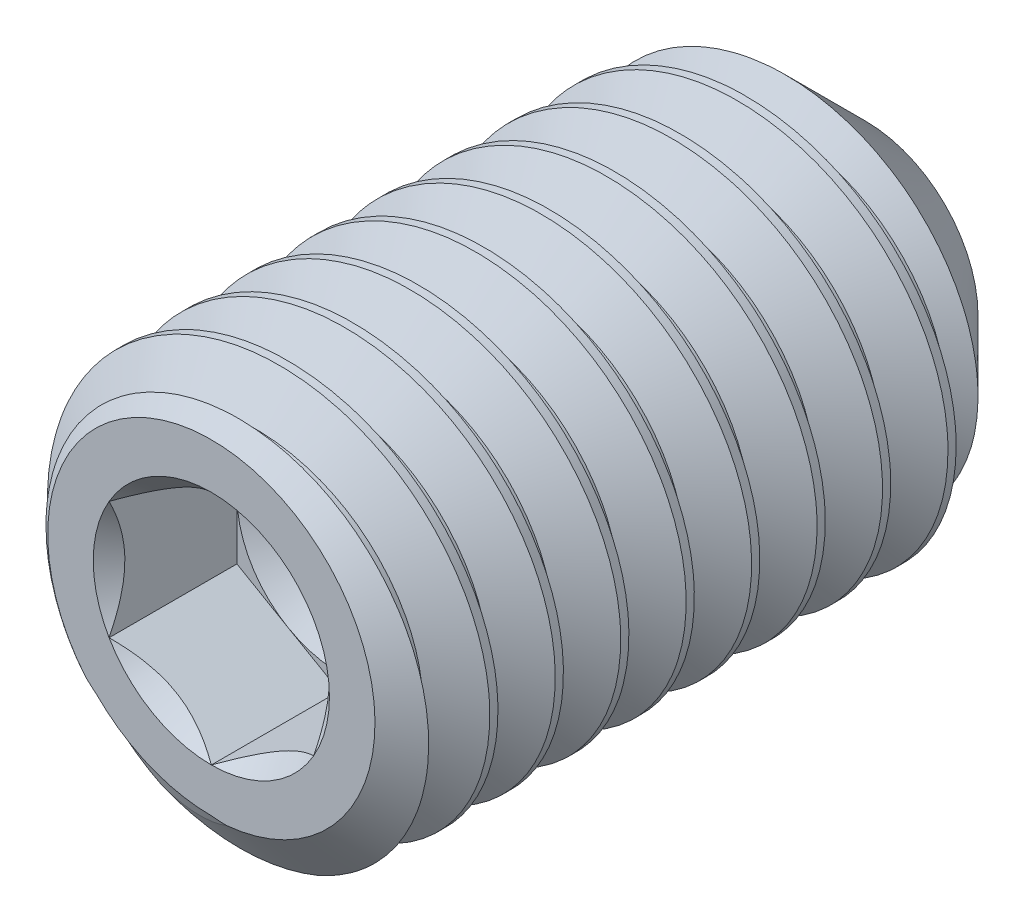
from build123d import *

# Parameters (mm, degrees)
CUT_SWEEP2_PITCH    = 0.8
CUT_EXTRUDE10_DEPTH = 1.5625


with BuildPart() as part:
    # Sketch22 → Revolve1 (revolve)
    with BuildSketch(Plane(origin=(0, 0, 0), x_dir=(0, 0, -1), z_dir=(1, 0, 0)), mode=Mode.PRIVATE) as revolve1_sk:
        Polygon((-3.588436834, 0), (-3.588436834, 2), (-3.238333065, 2.5), (3.281475432, 2.5), (4.411563166, 1.369912266), (3.588436834, 0), align=None)
    revolve(revolve1_sk.sketch.rotate(Axis((0, 0, -3.588436834), (0, 0, -1)), 180), axis=Axis((0, 0, -3.588436834), (0, 0, -1)))

    # Cut-Sweep2: the profile of Sketch28 profile screwed along a right-hand helix of 11 turns, 8 arcs to a turn; built about Z, then put on its axis
    cut_sweep2_z = Axis((0, 0, 0), (0, 0, 1))
    cut_sweep2_corners = [(2.5003, 0, 0.000173205), (2.5003, 0, -0.700173205), (1.980384758, 0, -0.4), (1.980384758, 0, -0.3)]
    with BuildLine(mode=Mode.PRIVATE) as cut_sweep2_profile:
        Line(cut_sweep2_corners[0], cut_sweep2_corners[1])
        Line(cut_sweep2_corners[1], cut_sweep2_corners[2])
        Line(cut_sweep2_corners[2], cut_sweep2_corners[3])
        Line(cut_sweep2_corners[3], cut_sweep2_corners[0])
    cut_sweep2_cap = Face(cut_sweep2_profile.wire())
    cut_sweep2_turn_angles = [0, 22.5, 45, 67.5, 90, 112.5, 135, 157.5, 180, 202.5, 225, 247.5, 270, 292.5, 315, 337.5, 360]
    cut_sweep2_turn_weights = [1, 0.9238795325112867, 1, 0.9238795325112867, 1, 0.9238795325112867, 1, 0.9238795325112867, 1, 0.9238795325112867, 1, 0.9238795325112867, 1, 0.9238795325112867, 1, 0.9238795325112867, 1]
    cut_sweep2_turn_rails = [Edge.make_bspline([Vector(p[0], p[1], 0).rotate(cut_sweep2_z, cut_sweep2_turn_angles[k]) / cut_sweep2_turn_weights[k] + Vector(0, 0, p[2] + CUT_SWEEP2_PITCH * cut_sweep2_turn_angles[k] / 360) for k in range(17)], [0, 0, 0, 1, 1, 2, 2, 3, 3, 4, 4, 5, 5, 6, 6, 7, 7, 8, 8, 8], 2, cut_sweep2_turn_weights) for p in cut_sweep2_corners]
    cut_sweep2_turn_sides = [Face.make_surface_from_curves(cut_sweep2_turn_rails[p[0]], cut_sweep2_turn_rails[p[1]]) for p in [(0, 1), (1, 2), (2, 3), (3, 0)]]
    cut_sweep2 = Plane(origin=(0, 0, -4.411563166), x_dir=(0, 1, 0), z_dir=(0, 0, 1)) * Solid(Shell([*[p.moved(Location((0, 0, CUT_SWEEP2_PITCH * i))) for i in range(11) for p in cut_sweep2_turn_sides], cut_sweep2_cap, cut_sweep2_cap.rotate(cut_sweep2_z, 3960).moved(Location((0, 0, CUT_SWEEP2_PITCH * 3960 / 360)))]))
    add(cut_sweep2, mode=Mode.SUBTRACT)

    # Sketch23 → Cut-Extrude10 (cut)
    with BuildSketch(Plane.XY.offset(3.588436834)):
        Polygon((0, 1.443375673), (-1.25, 0.721687836), (-1.25, -0.721687836), (0, -1.443375673), (1.25, -0.721687836), (1.25, 0.721687836), align=None)
    extrude(amount=-CUT_EXTRUDE10_DEPTH, mode=Mode.SUBTRACT)

    # Cut-Extrude11 cone 1 section (through the dimple's axis) → Cut-Extrude11 (revolve, cut)
    with BuildSketch(Plane(origin=(0, 0, 3.588436834), x_dir=(0, -1, 0), z_dir=(1, 0, 0))):
        Polygon((0, 0), (1.443375673, 0), (0, 1.443375673), align=None)
    revolve(axis=Axis((0, 0, 3.588436834), (0, 0, -1)), mode=Mode.SUBTRACT)

    # Cut-Extrude12 cone 1 section (through the dimple's axis) → Cut-Extrude12 (revolve, cut)
    with BuildSketch(Plane(origin=(0, 0, 2.025936834), x_dir=(0, -1, 0), z_dir=(1, 0, 0))):
        Polygon((0, 0), (1.25, 0), (0, 0.721687836), align=None)
    revolve(axis=Axis((0, 0, 2.025936834), (0, 0, -1)), mode=Mode.SUBTRACT)


solid = part.part
